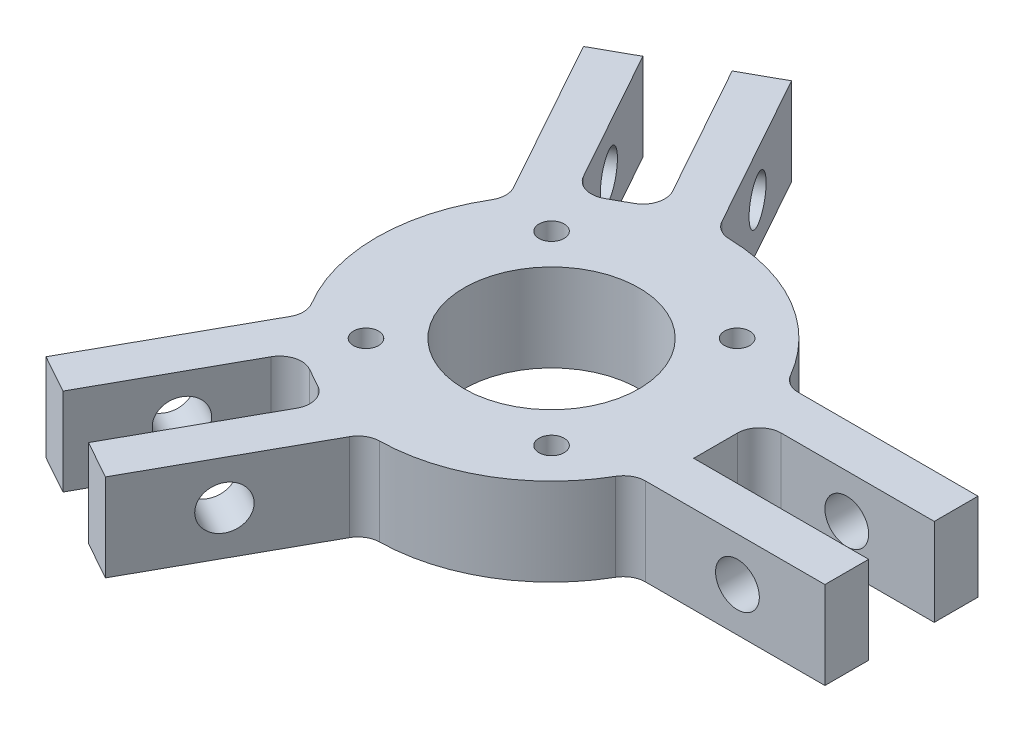
from build123d import *
from OCP.BRepAlgoAPI import BRepAlgoAPI_Cut
from OCP.TopTools import TopTools_ListOfShape

# Parameters (mm, degrees)
SKETCH1_R            = 12.7
SKETCH1_R_2          = 1.8288
BOSS_EXTRUDE1_DEPTH  = 6.35
SKETCH4_W            = 3.175
SKETCH4_H            = 6.35
SKETCH4_AT_POINT_2_W = 3.175
SKETCH4_AT_POINT_2_H = 6.35
SKETCH4_AT_POINT_3_W = 3.175
SKETCH4_AT_POINT_3_H = 6.35
SKETCH4_AT_POINT_4_W = 3.175
SKETCH4_AT_POINT_4_H = 6.35
SKETCH4_AT_POINT_5_W = 3.175
SKETCH4_AT_POINT_5_H = 6.35
SKETCH4_AT_POINT_6_W = 3.175
SKETCH4_AT_POINT_6_H = 6.35
FILLET1_R            = 3.175


with BuildPart() as part:
    # Sketch1 → Boss-Extrude1 (new, symmetric)
    with BuildSketch(Plane(origin=(0, 0, 0), x_dir=(1, 0, 0), z_dir=(0, 1, 0))):
        with BuildLine():
            Line((25.4, 4.7625), (25.4, -4.7625))
            Line((25.4, -4.7625), (50.8, -4.7625))
            Line((50.8, -4.7625), (50.8, -11.1125))
            Line((50.8, -11.1125), (22.84014763, -11.1125))
            ThreePointArc((22.84014763, -11.1125), (12.881044339, -21.891521115), (-1.378083513, -25.362588311))
            Line((-1.378083513, -25.362588311), (-14.956588173, -49.8038967))
            Line((-14.956588173, -49.8038967), (-20.507486876, -46.720064087))
            Line((-20.507486876, -46.720064087), (-8.172156424, -24.516469273))
            Line((-8.172156424, -24.516469273), (-16.498504479, -19.890720354))
            Line((-16.498504479, -19.890720354), (-28.833834931, -42.094315167))
            Line((-28.833834931, -42.094315167), (-34.384733635, -39.010482554))
            Line((-34.384733635, -39.010482554), (-20.806228974, -14.569174166))
            ThreePointArc((-20.806228974, -14.569174166), (-25.4, 0), (-20.806228974, 14.569174166))
            Line((-20.806228974, 14.569174166), (-34.384733635, 39.010482554))
            Line((-34.384733635, 39.010482554), (-28.833834931, 42.094315167))
            Line((-28.833834931, 42.094315167), (-16.498504479, 19.890720354))
            Line((-16.498504479, 19.890720354), (-8.172156424, 24.516469273))
            Line((-8.172156424, 24.516469273), (-20.507486876, 46.720064087))
            Line((-20.507486876, 46.720064087), (-14.956588173, 49.8038967))
            Line((-14.956588173, 49.8038967), (-1.378083513, 25.362588311))
            ThreePointArc((-1.378083513, 25.362588311), (12.881044339, 21.891521115), (22.84014763, 11.1125))
            Line((22.84014763, 11.1125), (50.8, 11.1125))
            Line((50.8, 11.1125), (50.8, 4.7625))
            Line((50.8, 4.7625), (25.4, 4.7625))
        make_face()
        Circle(SKETCH1_R, mode=Mode.SUBTRACT)
        with Locations((-13.470384182, 13.470384182)):
            Circle(SKETCH1_R_2, mode=Mode.SUBTRACT)
        with Locations((13.470384182, 13.470384182)):
            Circle(SKETCH1_R_2, mode=Mode.SUBTRACT)
        with Locations((13.470384182, -13.470384182)):
            Circle(SKETCH1_R_2, mode=Mode.SUBTRACT)
        with Locations((-13.470384182, -13.470384182)):
            Circle(SKETCH1_R_2, mode=Mode.SUBTRACT)
    extrude(amount=BOSS_EXTRUDE1_DEPTH, both=True)


with BuildPart() as f_1_4_0_25_diameter_hole1_tool:
    # Sketch4 → 1/4 (0.25) Diameter Hole1 (revolve)
    with BuildSketch(Plane(origin=(38.1, 0, -4.7625), x_dir=(0, -1, 0), z_dir=(1, 0, 0))):
        with Locations((1.5875, 3.175)):
            Rectangle(SKETCH4_W, SKETCH4_H)
    revolve(axis=Axis((38.1, 0, 1.5875), (0, 0, -1)))


with BuildPart() as part_1:
    add(part.part)

    # 1/4 (0.25) Diameter Hole1: cut by f_1_4_0_25_diameter_hole1_tool, with a tolerance
    f_1_4_0_25_diameter_hole1_stock = TopTools_ListOfShape()
    f_1_4_0_25_diameter_hole1_stock.Append(part_1.part.wrapped)
    f_1_4_0_25_diameter_hole1_tools = TopTools_ListOfShape()
    f_1_4_0_25_diameter_hole1_tools.Append(f_1_4_0_25_diameter_hole1_tool.part.wrapped)
    f_1_4_0_25_diameter_hole1_cut = BRepAlgoAPI_Cut()
    f_1_4_0_25_diameter_hole1_cut.SetArguments(f_1_4_0_25_diameter_hole1_stock)
    f_1_4_0_25_diameter_hole1_cut.SetTools(f_1_4_0_25_diameter_hole1_tools)
    f_1_4_0_25_diameter_hole1_cut.SetFuzzyValue(0.00001)
    f_1_4_0_25_diameter_hole1_cut.Build()
    add(Compound.cast(f_1_4_0_25_diameter_hole1_cut.Shape()).solids(), mode=Mode.REPLACE)


with BuildPart() as f_1_4_0_25_diameter_hole1_at_2_tool:
    # Sketch4 at point 2 (carried to point 2, square into its face) → 1/4 (0.25) Diameter Hole1 at 2 (revolve)
    with BuildSketch(Plane(origin=(-14.33982165, 0, -35.61826668), x_dir=(0, -1, 0), z_dir=(0.485643101, 0, 0.874157182))):
        with Locations((1.5875, 3.175)):
            Rectangle(SKETCH4_AT_POINT_2_W, SKETCH4_AT_POINT_2_H)
    revolve(axis=Axis((-19.890719755, 0, -32.534432989), (0.874157182, 0, -0.485643101)))


with BuildPart() as part_2:
    add(part_1.part)

    # 1/4 (0.25) Diameter Hole1 at 2: cut by f_1_4_0_25_diameter_hole1_at_2_tool, with a tolerance
    f_1_4_0_25_diameter_hole1_at_2_stock = TopTools_ListOfShape()
    f_1_4_0_25_diameter_hole1_at_2_stock.Append(part_2.part.wrapped)
    f_1_4_0_25_diameter_hole1_at_2_tools = TopTools_ListOfShape()
    f_1_4_0_25_diameter_hole1_at_2_tools.Append(f_1_4_0_25_diameter_hole1_at_2_tool.part.wrapped)
    f_1_4_0_25_diameter_hole1_at_2_cut = BRepAlgoAPI_Cut()
    f_1_4_0_25_diameter_hole1_at_2_cut.SetArguments(f_1_4_0_25_diameter_hole1_at_2_stock)
    f_1_4_0_25_diameter_hole1_at_2_cut.SetTools(f_1_4_0_25_diameter_hole1_at_2_tools)
    f_1_4_0_25_diameter_hole1_at_2_cut.SetFuzzyValue(0.00001)
    f_1_4_0_25_diameter_hole1_at_2_cut.Build()
    add(Compound.cast(f_1_4_0_25_diameter_hole1_at_2_cut.Shape()).solids(), mode=Mode.REPLACE)


with BuildPart() as f_1_4_0_25_diameter_hole1_at_3_tool:
    # Sketch4 at point 3 (carried to point 3, square into its face) → 1/4 (0.25) Diameter Hole1 at 3 (revolve)
    with BuildSketch(Plane(origin=(-22.666169705, 0, 30.99251776), x_dir=(0, -1, 0), z_dir=(0.485643101, 0, -0.874157182))):
        with Locations((1.5875, 3.175)):
            Rectangle(SKETCH4_AT_POINT_3_W, SKETCH4_AT_POINT_3_H)
    revolve(axis=Axis((-17.115271601, 0, 34.076351452), (-0.874157182, 0, -0.485643101)))


with BuildPart() as part_3:
    add(part_2.part)

    # 1/4 (0.25) Diameter Hole1 at 3: cut by f_1_4_0_25_diameter_hole1_at_3_tool, with a tolerance
    f_1_4_0_25_diameter_hole1_at_3_stock = TopTools_ListOfShape()
    f_1_4_0_25_diameter_hole1_at_3_stock.Append(part_3.part.wrapped)
    f_1_4_0_25_diameter_hole1_at_3_tools = TopTools_ListOfShape()
    f_1_4_0_25_diameter_hole1_at_3_tools.Append(f_1_4_0_25_diameter_hole1_at_3_tool.part.wrapped)
    f_1_4_0_25_diameter_hole1_at_3_cut = BRepAlgoAPI_Cut()
    f_1_4_0_25_diameter_hole1_at_3_cut.SetArguments(f_1_4_0_25_diameter_hole1_at_3_stock)
    f_1_4_0_25_diameter_hole1_at_3_cut.SetTools(f_1_4_0_25_diameter_hole1_at_3_tools)
    f_1_4_0_25_diameter_hole1_at_3_cut.SetFuzzyValue(0.00001)
    f_1_4_0_25_diameter_hole1_at_3_cut.Build()
    add(Compound.cast(f_1_4_0_25_diameter_hole1_at_3_cut.Shape()).solids(), mode=Mode.REPLACE)


with BuildPart() as f_1_4_0_25_diameter_hole1_at_4_tool:
    # Sketch4 at point 4 (carried to point 4, square into its face) → 1/4 (0.25) Diameter Hole1 at 4 (revolve)
    with BuildSketch(Plane(origin=(-14.33982165, 0, 35.61826668), x_dir=(0, -1, 0), z_dir=(-0.485643101, 0, 0.874157182))):
        with Locations((1.5875, 3.175)):
            Rectangle(SKETCH4_AT_POINT_4_W, SKETCH4_AT_POINT_4_H)
    revolve(axis=Axis((-19.890719755, 0, 32.534432989), (0.874157182, 0, 0.485643101)))


with BuildPart() as part_4:
    add(part_3.part)

    # 1/4 (0.25) Diameter Hole1 at 4: cut by f_1_4_0_25_diameter_hole1_at_4_tool, with a tolerance
    f_1_4_0_25_diameter_hole1_at_4_stock = TopTools_ListOfShape()
    f_1_4_0_25_diameter_hole1_at_4_stock.Append(part_4.part.wrapped)
    f_1_4_0_25_diameter_hole1_at_4_tools = TopTools_ListOfShape()
    f_1_4_0_25_diameter_hole1_at_4_tools.Append(f_1_4_0_25_diameter_hole1_at_4_tool.part.wrapped)
    f_1_4_0_25_diameter_hole1_at_4_cut = BRepAlgoAPI_Cut()
    f_1_4_0_25_diameter_hole1_at_4_cut.SetArguments(f_1_4_0_25_diameter_hole1_at_4_stock)
    f_1_4_0_25_diameter_hole1_at_4_cut.SetTools(f_1_4_0_25_diameter_hole1_at_4_tools)
    f_1_4_0_25_diameter_hole1_at_4_cut.SetFuzzyValue(0.00001)
    f_1_4_0_25_diameter_hole1_at_4_cut.Build()
    add(Compound.cast(f_1_4_0_25_diameter_hole1_at_4_cut.Shape()).solids(), mode=Mode.REPLACE)


with BuildPart() as f_1_4_0_25_diameter_hole1_at_5_tool:
    # Sketch4 at point 5 (carried to point 5, square into its face) → 1/4 (0.25) Diameter Hole1 at 5 (revolve)
    with BuildSketch(Plane(origin=(-22.666169705, 0, -30.99251776), x_dir=(0, -1, 0), z_dir=(-0.485643101, 0, -0.874157182))):
        with Locations((1.5875, 3.175)):
            Rectangle(SKETCH4_AT_POINT_5_W, SKETCH4_AT_POINT_5_H)
    revolve(axis=Axis((-17.115271601, 0, -34.076351452), (-0.874157182, 0, 0.485643101)))


with BuildPart() as part_5:
    add(part_4.part)

    # 1/4 (0.25) Diameter Hole1 at 5: cut by f_1_4_0_25_diameter_hole1_at_5_tool, with a tolerance
    f_1_4_0_25_diameter_hole1_at_5_stock = TopTools_ListOfShape()
    f_1_4_0_25_diameter_hole1_at_5_stock.Append(part_5.part.wrapped)
    f_1_4_0_25_diameter_hole1_at_5_tools = TopTools_ListOfShape()
    f_1_4_0_25_diameter_hole1_at_5_tools.Append(f_1_4_0_25_diameter_hole1_at_5_tool.part.wrapped)
    f_1_4_0_25_diameter_hole1_at_5_cut = BRepAlgoAPI_Cut()
    f_1_4_0_25_diameter_hole1_at_5_cut.SetArguments(f_1_4_0_25_diameter_hole1_at_5_stock)
    f_1_4_0_25_diameter_hole1_at_5_cut.SetTools(f_1_4_0_25_diameter_hole1_at_5_tools)
    f_1_4_0_25_diameter_hole1_at_5_cut.SetFuzzyValue(0.00001)
    f_1_4_0_25_diameter_hole1_at_5_cut.Build()
    add(Compound.cast(f_1_4_0_25_diameter_hole1_at_5_cut.Shape()).solids(), mode=Mode.REPLACE)


with BuildPart() as f_1_4_0_25_diameter_hole1_at_6_tool:
    # Sketch4 at point 6 (carried to point 6, square into its face) → 1/4 (0.25) Diameter Hole1 at 6 (revolve)
    with BuildSketch(Plane(origin=(38.1, 0, 4.7625), x_dir=(0, -1, 0), z_dir=(-1, 0, 0))):
        with Locations((1.5875, 3.175)):
            Rectangle(SKETCH4_AT_POINT_6_W, SKETCH4_AT_POINT_6_H)
    revolve(axis=Axis((38.1, 0, -1.5875), (0, 0, 1)))


with BuildPart() as part_6:
    add(part_5.part)

    # 1/4 (0.25) Diameter Hole1 at 6: cut by f_1_4_0_25_diameter_hole1_at_6_tool, with a tolerance
    f_1_4_0_25_diameter_hole1_at_6_stock = TopTools_ListOfShape()
    f_1_4_0_25_diameter_hole1_at_6_stock.Append(part_6.part.wrapped)
    f_1_4_0_25_diameter_hole1_at_6_tools = TopTools_ListOfShape()
    f_1_4_0_25_diameter_hole1_at_6_tools.Append(f_1_4_0_25_diameter_hole1_at_6_tool.part.wrapped)
    f_1_4_0_25_diameter_hole1_at_6_cut = BRepAlgoAPI_Cut()
    f_1_4_0_25_diameter_hole1_at_6_cut.SetArguments(f_1_4_0_25_diameter_hole1_at_6_stock)
    f_1_4_0_25_diameter_hole1_at_6_cut.SetTools(f_1_4_0_25_diameter_hole1_at_6_tools)
    f_1_4_0_25_diameter_hole1_at_6_cut.SetFuzzyValue(0.00001)
    f_1_4_0_25_diameter_hole1_at_6_cut.Build()
    add(Compound.cast(f_1_4_0_25_diameter_hole1_at_6_cut.Shape()).solids(), mode=Mode.REPLACE)

    # Fillet1
    fillet1_edges = [part_6.edges().sort_by_distance(p)[0] for p in [
        (-20.806228974, 0, 14.569174166),
        (-16.498504479, 0, 19.890720354),
        (-8.172156424, 0, 24.516469273),
        (-1.378083513, 0, 25.362588311),
        (22.84014763, 0, 11.1125),
        (25.4, 0, -4.7625),
        (22.84014763, 0, -11.1125),
        (-1.378083513, 0, -25.362588311),
        (-8.172156424, 0, -24.516469273),
        (-16.498504479, 0, -19.890720354),
        (-20.806228974, 0, -14.569174166),
    ]]
    fillet(fillet1_edges, radius=FILLET1_R)


solid = part_6.part
